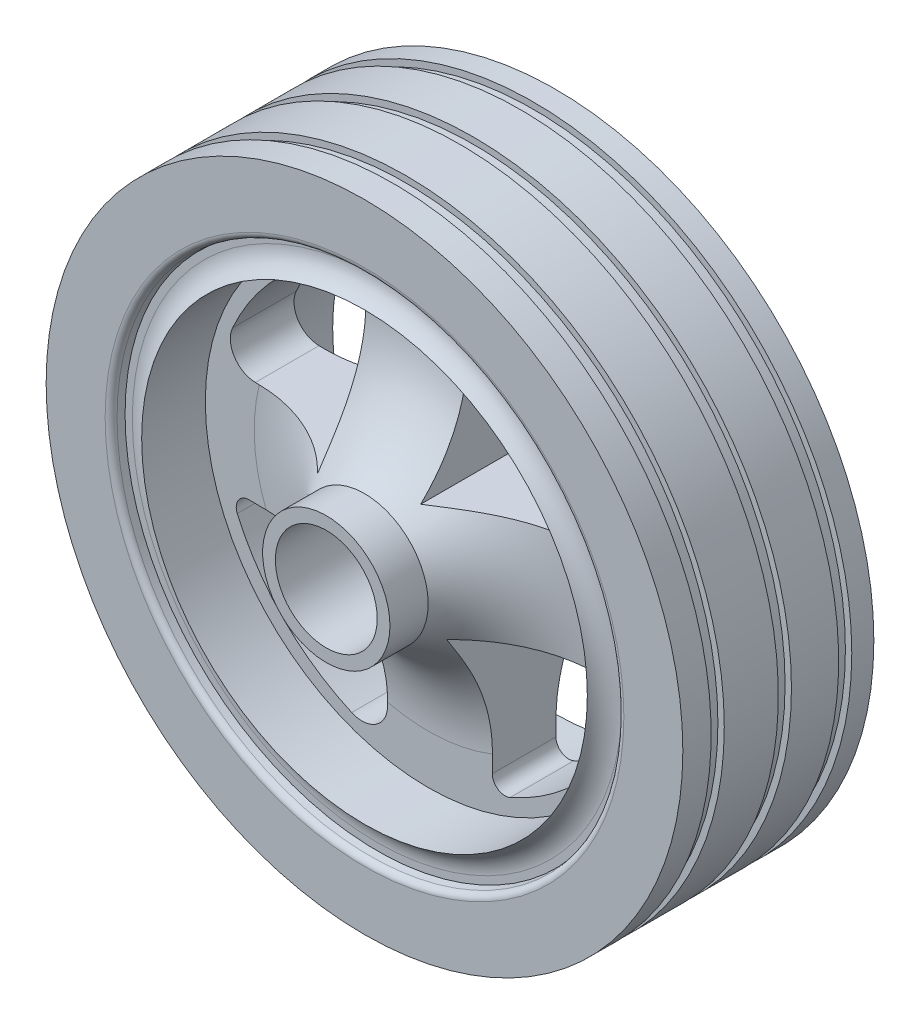
from build123d import *

# Parameters (mm, degrees)
SKETCH1_R                 = 25
BOSS_EXTRUDE1_DEPTH       = 7.5
SKETCH2_R                 = 17.5
SKETCH2_R_2               = 5
CUT_EXTRUDE1_DEPTH        = 5
FILLET1_R                 = 10
FILLET2_R                 = 10
CUT_EXTRUDE2_DEPTH        = 37.742346142
CUT_EXTRUDE3_DEPTH        = 37.742346142
CUT_EXTRUDE4_DEPTH        = 37.742346169
CUT_EXTRUDE5_DEPTH        = 37.742346169
CUT_EXTRUDE6_DEPTH        = 37.742346169
SKETCH11_R                = 5
BOSS_EXTRUDE2_DEPTH       = 3
SKETCH13_R                = 4
CUT_EXTRUDE7_DEPTH        = 13
FILLET3_R                 = 5
SKETCH14_R                = 19.926191628
SKETCH14_R_2              = 17.5
CUT_EXTRUDE8_DEPTH        = 1
CUT_EXTRUDE8_DRAFT        = -7
FILLET4_R                 = 2
FILLET5_R                 = 0.5
MIRROR5_COPY_1_SKETCH_R   = 19.926191628
MIRROR5_COPY_1_SKETCH_R_2 = 17.5
MIRROR5_COPY_1_DEPTH      = 1
MIRROR5_COPY_1_DRAFT      = -7
FILLET4_OF_MIRROR5_R      = 2
FILLET6_R                 = 0.5
SKETCH15_W                = 1.820535656
SKETCH15_H                = 1.028998415
SKETCH15_H_2              = 1.028998414


with BuildPart() as part:
    # Sketch1 → Boss-Extrude1 (new, symmetric)
    with BuildSketch(Plane.XY):
        Circle(SKETCH1_R)
    extrude(amount=BOSS_EXTRUDE1_DEPTH, both=True)

    # Sketch2 → Cut-Extrude1 (cut)
    with BuildSketch(Plane.XY.offset(7.5)):
        Circle(SKETCH2_R)
        Circle(SKETCH2_R_2, mode=Mode.SUBTRACT)
    cut_extrude1 = extrude(amount=-CUT_EXTRUDE1_DEPTH, mode=Mode.SUBTRACT)

    # Mirror2: Cut-Extrude1 across plane
    add(cut_extrude1.mirror(Plane.XY), mode=Mode.SUBTRACT)

    # Fillet1
    # the kernel refuses this fillet: 10 mm, written as the material it adds along each edge
    with BuildSketch(Plane(origin=(0, 0, 2.5), x_dir=(1, 0, 0), z_dir=(0, -1, 0))) as fillet1_piece_1:
        with BuildLine():
            CenterArc((13.660254038, 10), FILLET1_R, 210, 60)
            Line((5, 5), (4.826794919, 4.9))
            ThreePointArc((4.826794919, 4.9), (4.8, 2.5), (4.8, 0))
            Line((4.8, 0), (5, -0.2))
            Line((5, -0.2), (13.660254038, -0.2))
            Line((13.660254038, -0.2), (13.660254038, 0))
        make_face()
    revolve(axis=Axis((0, 0, 2.5), (0, 0, 1)))

    # Fillet2
    # the kernel refuses this fillet: 10 mm, written as the material it adds along each edge
    with BuildSketch(Plane(origin=(0, 0, -2.5), x_dir=(1, 0, 0), z_dir=(0, -1, 0))) as fillet2_piece_1:
        with BuildLine():
            CenterArc((13.660254038, -10), FILLET2_R, 90, 60)
            Line((5, -5), (4.826794919, -4.9))
            ThreePointArc((4.826794919, -4.9), (4.8, -2.5), (4.8, 0))
            Line((4.8, 0), (5, 0.2))
            Line((5, 0.2), (13.660254038, 0.2))
            Line((13.660254038, 0.2), (13.660254038, 0))
        make_face()
    revolve(axis=Axis((0, 0, -2.5), (0, 0, 1)))

    # Sketch5 → Cut-Extrude2 (cut, through all)
    with BuildSketch(Plane.XY.offset(2.5)):
        with BuildLine():
            Line((5.095441165, -3.071898814), (5.03444116, -14.033890607))
            ThreePointArc((5.03444116, -14.033890607), (5.485920849, -14.875602591), (6.437808609, -14.954486465))
            ThreePointArc((6.437808609, -14.954486465), (11.785461719, -11.283236794), (15.428545994, -5.916356426))
            ThreePointArc((15.428545994, -5.916356426), (15.269775583, -4.027127841), (13.605396479, -3.119254015))
            Line((13.605396479, -3.119254015), (5.095441165, -3.071898814))
        make_face()
        with BuildLine():
            Line((3.043497179, 5.112456152), (14.005658694, 5.112456152))
            ThreePointArc((14.005658694, 5.112456152), (14.844845344, 5.568612639), (14.918431126, 6.520924619))
            ThreePointArc((14.918431126, 6.520924619), (11.217480763, 11.84806591), (5.830411193, 15.461229258))
            ThreePointArc((5.830411193, 15.461229258), (3.942095351, 15.291948511), (3.043497179, 13.622543223))
            Line((3.043497179, 13.622543223), (3.043497179, 5.112456152))
        make_face()
        with BuildLine():
            Line((-3.100205327, -5.078268398), (-14.061687961, -4.956270275))
            ThreePointArc((-14.061687961, -4.956270275), (-14.905899216, -5.403059187), (-14.99007874, -6.354493253))
            ThreePointArc((-14.99007874, -6.354493253), (-11.348643441, -11.722492591), (-6.002118459, -15.395384986))
            ThreePointArc((-6.002118459, -15.395384986), (-4.112035631, -15.247129828), (-3.194914262, -13.587828443))
            Line((-3.194914262, -13.587828443), (-3.100205327, -5.078268398))
        make_face()
        with BuildLine():
            Line((-5.060938382, 3.128415843), (-4.87794592, 14.089049896))
            ThreePointArc((-4.87794592, 14.089049896), (-5.32003022, 14.93573428), (-6.27098113, 15.025206847))
            ThreePointArc((-6.27098113, 15.025206847), (-11.659160476, 11.413698677), (-15.36174726, 6.087694636))
            ThreePointArc((-15.36174726, 6.087694636), (-15.224011945, 4.196816091), (-13.569839661, 3.27047558))
            Line((-13.569839661, 3.27047558), (-5.060938382, 3.128415843))
        make_face()
    extrude(amount=-CUT_EXTRUDE2_DEPTH, mode=Mode.SUBTRACT)

    # Sketch6 → Cut-Extrude3 (cut, through all)
    with BuildSketch(Plane(origin=(0, 0, -2.5), x_dir=(-1, 0, 0), z_dir=(0, 0, -1))):
        with BuildLine():
            Line((5.060938382, 3.128415843), (4.900284085, 12.751068828))
            ThreePointArc((4.900284085, 12.751068828), (10.246073638, 9.034407306), (13.264233008, 3.265373346))
            Line((13.264233008, 3.265373346), (5.060938382, 3.128415843))
        make_face()
    extrude(amount=-CUT_EXTRUDE3_DEPTH, mode=Mode.SUBTRACT)

    # Sketch8 → Cut-Extrude4 (cut, through all)
    with BuildSketch(Plane(origin=(0, 0, 2.5), x_dir=(-1, 0, 0), z_dir=(0, 0, -1))):
        with BuildLine():
            Line((-12.667491167, 5.112456152), (-3.043497179, 5.112456152))
            Line((-3.043497179, 5.112456152), (-3.043497179, 13.316893981))
            ThreePointArc((-3.043497179, 13.316893981), (-8.862109722, 10.395458222), (-12.667491167, 5.112456152))
        make_face()
    extrude(amount=-CUT_EXTRUDE4_DEPTH, mode=Mode.SUBTRACT)

    # Sketch9 → Cut-Extrude5 (cut, through all)
    with BuildSketch(Plane(origin=(0, 0, 2.5), x_dir=(-1, 0, 0), z_dir=(0, 0, -1))):
        with BuildLine():
            Line((-5.041887522, -12.695743798), (-5.095441165, -3.071898814))
            Line((-5.095441165, -3.071898814), (-13.299751969, -3.1175532))
            ThreePointArc((-13.299751969, -3.1175532), (-10.34598321, -8.919819045), (-5.041887522, -12.695743798))
        make_face()
    extrude(amount=-CUT_EXTRUDE5_DEPTH, mode=Mode.SUBTRACT)

    # Sketch10 → Cut-Extrude6 (cut, through all)
    with BuildSketch(Plane(origin=(0, 0, 2.5), x_dir=(-1, 0, 0), z_dir=(0, 0, -1))):
        with BuildLine():
            Line((12.723603306, -4.971162769), (3.100205327, -5.078268398))
            Line((3.100205327, -5.078268398), (3.191512685, -13.28219813))
            ThreePointArc((3.191512685, -13.28219813), (8.977252166, -10.296187835), (12.723603306, -4.971162769))
        make_face()
    extrude(amount=-CUT_EXTRUDE6_DEPTH, mode=Mode.SUBTRACT)

    # Sketch11 → Boss-Extrude2 (add)
    with BuildSketch(Plane.XY.offset(7.5)):
        Circle(SKETCH11_R)
    extrude(amount=BOSS_EXTRUDE2_DEPTH)

    # Sketch13 → Cut-Extrude7 (cut)
    with BuildSketch(Plane.XY.offset(10.5)):
        Circle(SKETCH13_R)
    extrude(amount=-CUT_EXTRUDE7_DEPTH, mode=Mode.SUBTRACT)

    # Fillet3
    # the kernel refuses this fillet: 5 mm, written as the material it takes off along each edge
    with BuildSketch(Plane(origin=(0, 0, -7.5), x_dir=(1, 0, 0), z_dir=(0, -1, 0))) as fillet3_piece_1:
        with BuildLine():
            CenterArc((2.47991415, 5), FILLET3_R, 270, 48.189685104)
            Line((2.47991415, 0), (5, 0))
            ThreePointArc((5, 0), (5.560365486, 0.864452698), (6.206694113, 1.666666667))
        make_face()
    revolve(axis=Axis((0, 0, -7.5), (0, 0, 1)), mode=Mode.SUBTRACT)


with BuildPart() as cut_extrude8_tool:
    # Sketch14 → Cut-Extrude8 (with draft: the straight prism first)
    with BuildSketch(Plane(origin=(0, 0, -7.5), x_dir=(-1, 0, 0), z_dir=(0, 0, -1))):
        Circle(SKETCH14_R)
        with Locations(Location((0, 0, 0), (0, 0, 180))):
            Circle(SKETCH14_R_2, mode=Mode.SUBTRACT)
    extrude(amount=-CUT_EXTRUDE8_DEPTH)
    # Cut-Extrude8: the draft: its side faces are tilted about the plane it starts from
    cut_extrude8_sides = [cut_extrude8_tool.faces().sort_by_distance(p)[0] for p in [
        (19.926191628, 0, -7),
        (-17.5, 0, -7),
    ]]
    draft(cut_extrude8_sides, Plane(origin=(0, 0, -7.5), x_dir=(-1, 0, 0), z_dir=(0, 0, -1)), CUT_EXTRUDE8_DRAFT)


with BuildPart() as part_1:
    add(part.part)

    # Cut-Extrude8: cut by cut_extrude8_tool
    add(cut_extrude8_tool.part, mode=Mode.SUBTRACT)

    # Fillet4
    # the kernel refuses this fillet: 2 mm, written as the material it adds along each edge
    with BuildSketch(Plane(origin=(0, 0, -6.5), x_dir=(1, 0, 0), z_dir=(0, 1, 0))) as fillet4_piece_1_section:
        with BuildLine():
            CenterArc((19.232050808, 2), FILLET4_R, 210, 60)
            Line((19.232050808, 0), (19.232050808, -0.04))
            Line((19.232050808, -0.04), (17.622784561, -0.04))
            Line((17.622784561, -0.04), (17.583082715, -0.004874774))
            ThreePointArc((17.583082715, -0.004874774), (17.521690434, 0.495125226), (17.465358984, 0.98))
            Line((17.465358984, 0.98), (17.5, 1))
        make_face()
    fillet4_piece_1 = revolve(axis=Axis((0, 0, -6.5), (0, 0, -1)), mode=Mode.PRIVATE)
    fillet4_piece_1 = fillet4_piece_1 - Plane(origin=(0, 0, -6.733823908), x_dir=(1, 0, 0), z_dir=(0, 0, -1)) * Cylinder(17.5, 77, mode=Mode.PRIVATE)
    add(fillet4_piece_1)

    # Fillet5
    fillet5_edges = [part_1.edges().sort_by_distance(p)[0] for p in [
        (19.926191628, 0, -7.5),
    ]]
    fillet(fillet5_edges, radius=FILLET5_R)


with BuildPart() as mirror5_copy_1_tool:
    # Mirror5 copy 1 sketch → Mirror5 copy 1 (with draft: the straight prism first)
    with BuildSketch(Plane(origin=(0, 0, 7.5), x_dir=(-1, 0, 0), z_dir=(0, 0, 1))):
        Circle(MIRROR5_COPY_1_SKETCH_R)
        Circle(MIRROR5_COPY_1_SKETCH_R_2, mode=Mode.SUBTRACT)
    extrude(amount=-MIRROR5_COPY_1_DEPTH)
    # Mirror5 copy 1: the draft: its side faces are tilted about the plane it starts from
    mirror5_copy_1_sides = [mirror5_copy_1_tool.faces().sort_by_distance(p)[0] for p in [
        (19.926191628, 0, 7),
        (-17.5, 0, 7),
    ]]
    draft(mirror5_copy_1_sides, Plane(origin=(0, 0, 7.5), x_dir=(-1, 0, 0), z_dir=(0, 0, 1)), MIRROR5_COPY_1_DRAFT)


with BuildPart() as part_2:
    add(part_1.part)

    # Mirror5 copy 1: cut by mirror5_copy_1_tool
    add(mirror5_copy_1_tool.part, mode=Mode.SUBTRACT)

    # Fillet4 of Mirror5
    # the kernel refuses this fillet: 2 mm, written as the material it adds along each edge
    with BuildSketch(Plane(origin=(0, 0, 6.5), x_dir=(-1, 0, 0), z_dir=(0, 1, 0))) as fillet4_of_mirror5_piece_1_section:
        with BuildLine():
            CenterArc((19.232050808, 2), FILLET4_OF_MIRROR5_R, 210, 60)
            Line((17.5, 1), (17.465358984, 0.98))
            ThreePointArc((17.465358984, 0.98), (17.521690434, 0.495125226), (17.583082715, -0.004874774))
            Line((17.583082715, -0.004874774), (17.622784561, -0.04))
            Line((17.622784561, -0.04), (19.232050808, -0.04))
            Line((19.232050808, -0.04), (19.232050808, 0))
        make_face()
    fillet4_of_mirror5_piece_1 = revolve(axis=Axis((0, 0, 6.5), (0, 0, 1)), mode=Mode.PRIVATE)
    fillet4_of_mirror5_piece_1 = fillet4_of_mirror5_piece_1 - Plane(origin=(0, 0, 6.733823908), x_dir=(1, 0, 0), z_dir=(0, 0, 1)) * Cylinder(17.5, 77, mode=Mode.PRIVATE)
    add(fillet4_of_mirror5_piece_1)

    # Fillet6
    fillet6_edges = [part_2.edges().sort_by_distance(p)[0] for p in [
        (19.926191628, 0, 7.5),
    ]]
    fillet(fillet6_edges, radius=FILLET6_R)

    # Sketch15 → Cut-Revolve1 (revolve, cut)
    with BuildSketch(Plane(origin=(0, 0, 0), x_dir=(1, 0, 0), z_dir=(0, 1, 0)), mode=Mode.PRIVATE) as cut_revolve1_sk:
        with Locations((25.410267828, 5.25241738)):
            Rectangle(SKETCH15_W, SKETCH15_H)
        with Locations((25.410267828, 0.514499207)):
            Rectangle(SKETCH15_W, SKETCH15_H_2)
        with Locations((25.410267828, -4.760528731)):
            Rectangle(SKETCH15_W, SKETCH15_H)
    revolve(cut_revolve1_sk.sketch.rotate(Axis((0, 0, -16.525664739), (0, 0, 1)), 180), axis=Axis((0, 0, -16.525664739), (0, 0, 1)), mode=Mode.SUBTRACT)


solid = part_2.part
